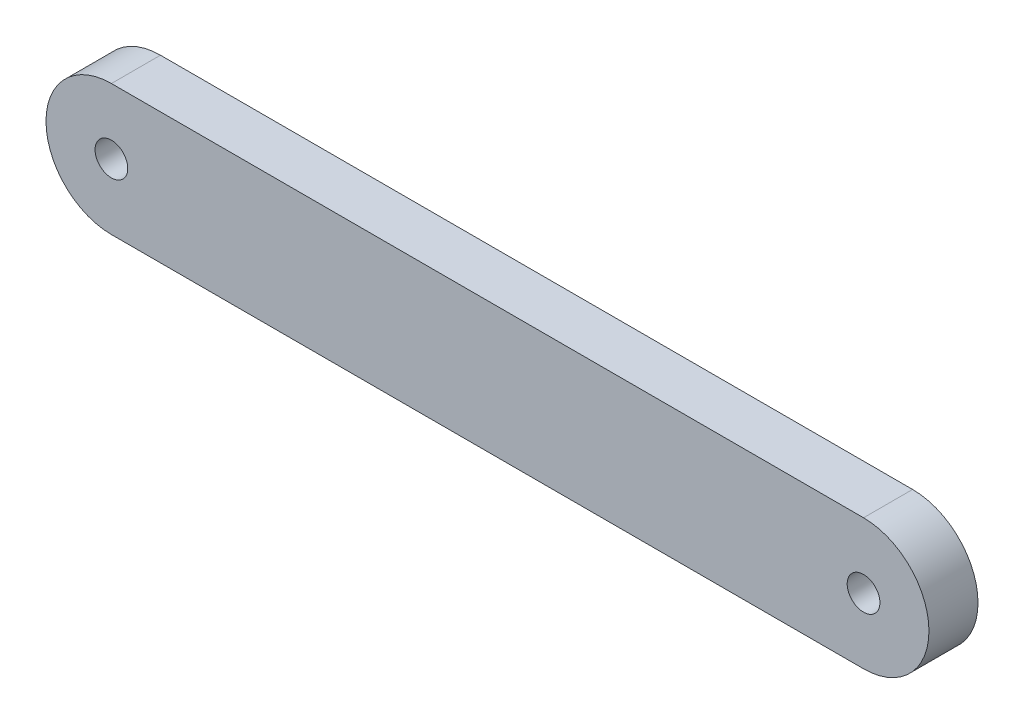
from build123d import *

# Parameters (mm, degrees)
ESQUISSE1_R        = 1
BOSS_EXTRU_1_DEPTH = 3


with BuildPart() as part:
    # Esquisse1 → Boss.-Extru.1 (new body)
    with BuildSketch(Plane.XY):
        with BuildLine():
            Line((50, 8), (4, 8))
            ThreePointArc((4, 8), (0, 4), (4, 0))
            Line((4, 0), (50, 0))
            ThreePointArc((50, 0), (54, 4), (50, 8))
        make_face()
        with Locations((4, 4)):
            Circle(ESQUISSE1_R, mode=Mode.SUBTRACT)
        with Locations((50, 4)):
            Circle(ESQUISSE1_R, mode=Mode.SUBTRACT)
    extrude(amount=BOSS_EXTRU_1_DEPTH)


solid = part.part
